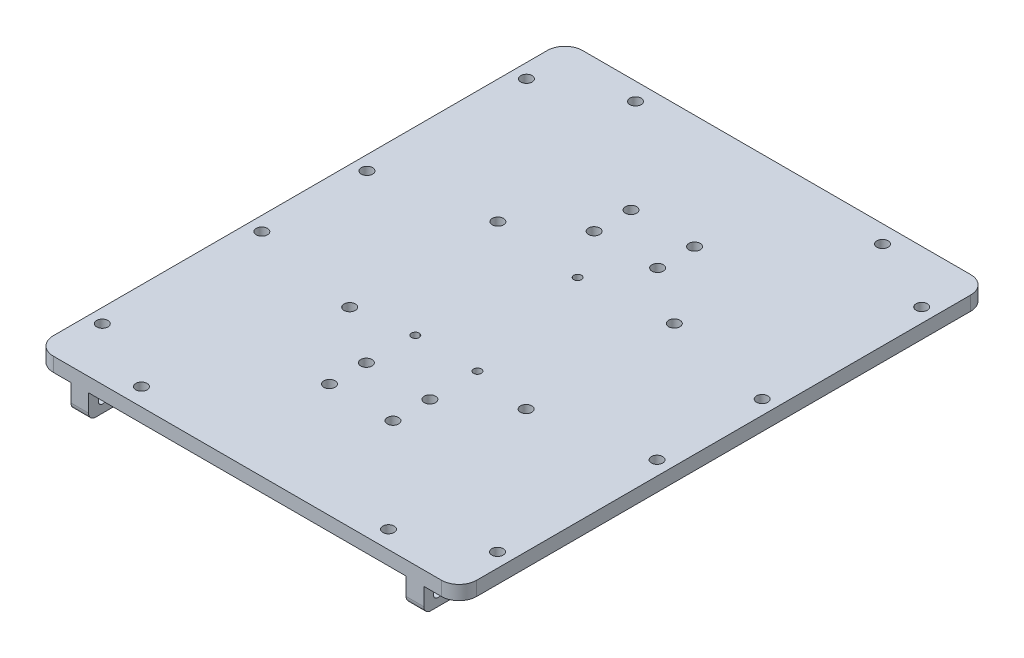
from build123d import *

# Parameters (mm, degrees)
SKETCH_1_W      = 120
SKETCH_1_H      = 150
SKETCH_1_R      = 1.6
SKETCH_1_R_2    = 1.1
EXTRUDE_1_DEPTH = 4
SKETCH_2_R      = 1.25
EXTRUDE_2_DEPTH = 5
FILLET_1_R      = 5
FILLET_3_R      = 2


with BuildPart() as part:
    # 草图1 → 凸台-拉伸1 (new body)
    with BuildSketch(Plane(origin=(0, 0, 0), x_dir=(1, 0, 0), z_dir=(0, 1, 0))):
        Rectangle(SKETCH_1_W, SKETCH_1_H)
        with Locations((-56, 60.1)):
            Circle(SKETCH_1_R, mode=Mode.SUBTRACT)
        with Locations((-56, 14.9)):
            Circle(SKETCH_1_R, mode=Mode.SUBTRACT)
        with Locations((-9, 42.73)):
            Circle(SKETCH_1_R, mode=Mode.SUBTRACT)
        with Locations((-9, 32.27)):
            Circle(SKETCH_1_R, mode=Mode.SUBTRACT)
        with Locations((-56, -14.9)):
            Circle(SKETCH_1_R, mode=Mode.SUBTRACT)
        with Locations((-9, -32.27)):
            Circle(SKETCH_1_R, mode=Mode.SUBTRACT)
        with Locations((-9, -42.73)):
            Circle(SKETCH_1_R, mode=Mode.SUBTRACT)
        with Locations((-56, -60.1)):
            Circle(SKETCH_1_R, mode=Mode.SUBTRACT)
        with Locations((56, -60.1)):
            Circle(SKETCH_1_R, mode=Mode.SUBTRACT)
        with Locations((9, -42.73)):
            Circle(SKETCH_1_R, mode=Mode.SUBTRACT)
        with Locations((9, -32.27)):
            Circle(SKETCH_1_R, mode=Mode.SUBTRACT)
        with Locations((56, -14.9)):
            Circle(SKETCH_1_R, mode=Mode.SUBTRACT)
        with Locations((56, 14.9)):
            Circle(SKETCH_1_R, mode=Mode.SUBTRACT)
        with Locations((9, 32.27)):
            Circle(SKETCH_1_R, mode=Mode.SUBTRACT)
        with Locations((9, 42.73)):
            Circle(SKETCH_1_R, mode=Mode.SUBTRACT)
        with Locations((56, 60.1)):
            Circle(SKETCH_1_R, mode=Mode.SUBTRACT)
        with Locations((0, 18.6)):
            Circle(SKETCH_1_R_2, mode=Mode.SUBTRACT)
        with Locations((8.8, -18.6)):
            Circle(SKETCH_1_R_2, mode=Mode.SUBTRACT)
        with Locations((-8.8, -18.6)):
            Circle(SKETCH_1_R_2, mode=Mode.SUBTRACT)
        with Locations((-25, 21)):
            Circle(SKETCH_1_R, mode=Mode.SUBTRACT)
        with Locations((25, 21)):
            Circle(SKETCH_1_R, mode=Mode.SUBTRACT)
        with Locations((25, -21)):
            Circle(SKETCH_1_R, mode=Mode.SUBTRACT)
        with Locations((-25, -21)):
            Circle(SKETCH_1_R, mode=Mode.SUBTRACT)
        with Locations((35, 70)):
            Circle(SKETCH_1_R, mode=Mode.SUBTRACT)
        with Locations((-35, 70)):
            Circle(SKETCH_1_R, mode=Mode.SUBTRACT)
        with Locations((-35, -70)):
            Circle(SKETCH_1_R, mode=Mode.SUBTRACT)
        with Locations((35, -70)):
            Circle(SKETCH_1_R, mode=Mode.SUBTRACT)
    extrude(amount=EXTRUDE_1_DEPTH)

    # 草图2 → 凸台-拉伸2 (add)
    # profile 1 of 2: a face of its own
    with BuildSketch(Plane.ZY.offset(50)):
        Polygon((75, 0), (45, 0), (57.124355653, -7), (75, -7), align=None)
        with Locations((59, -3.5)):
            Circle(SKETCH_2_R, mode=Mode.SUBTRACT)
        with Locations((65, -3.5)):
            Circle(SKETCH_2_R, mode=Mode.SUBTRACT)
        with Locations((71, -3.5)):
            Circle(SKETCH_2_R, mode=Mode.SUBTRACT)
    # profile 2 of 2: a face of its own
    with BuildSketch(Plane.ZY.offset(50)):
        Polygon((-45, 0), (-75, 0), (-75, -7), (-57.124355653, -7), align=None)
        with Locations((-71, -3.5)):
            Circle(SKETCH_2_R, mode=Mode.SUBTRACT)
        with Locations((-65, -3.5)):
            Circle(SKETCH_2_R, mode=Mode.SUBTRACT)
        with Locations((-59, -3.5)):
            Circle(SKETCH_2_R, mode=Mode.SUBTRACT)
    extrude_2 = extrude(amount=-EXTRUDE_2_DEPTH)

    # 镜向1: 凸台-拉伸2 across plane
    add(extrude_2.mirror(Plane.ZY))

    # 圆角1
    fillet_1_edges = [part.edges().sort_by_distance(p)[0] for p in [
        (-60, 2, -75),
        (60, 2, -75),
        (60, 2, 75),
        (-60, 2, 75),
    ]]
    fillet(fillet_1_edges, radius=FILLET_1_R)

    # 圆角3
    fillet_3_edges = [part.edges().sort_by_distance(p)[0] for p in [
        (-47.5, 0, 45),
        (-47.5, -7, 57.124355653),
        (-47.5, -7, 75),
        (47.5, -7, 75),
        (47.5, -7, 57.124355653),
        (47.5, 0, 45),
        (47.5, 0, -45),
        (-47.5, 0, -45),
        (47.5, -7, -75),
        (47.5, -7, -57.124355653),
        (-47.5, -7, -57.124355653),
        (-47.5, -7, -75),
    ]]
    fillet(fillet_3_edges, radius=FILLET_3_R)


solid = part.part
